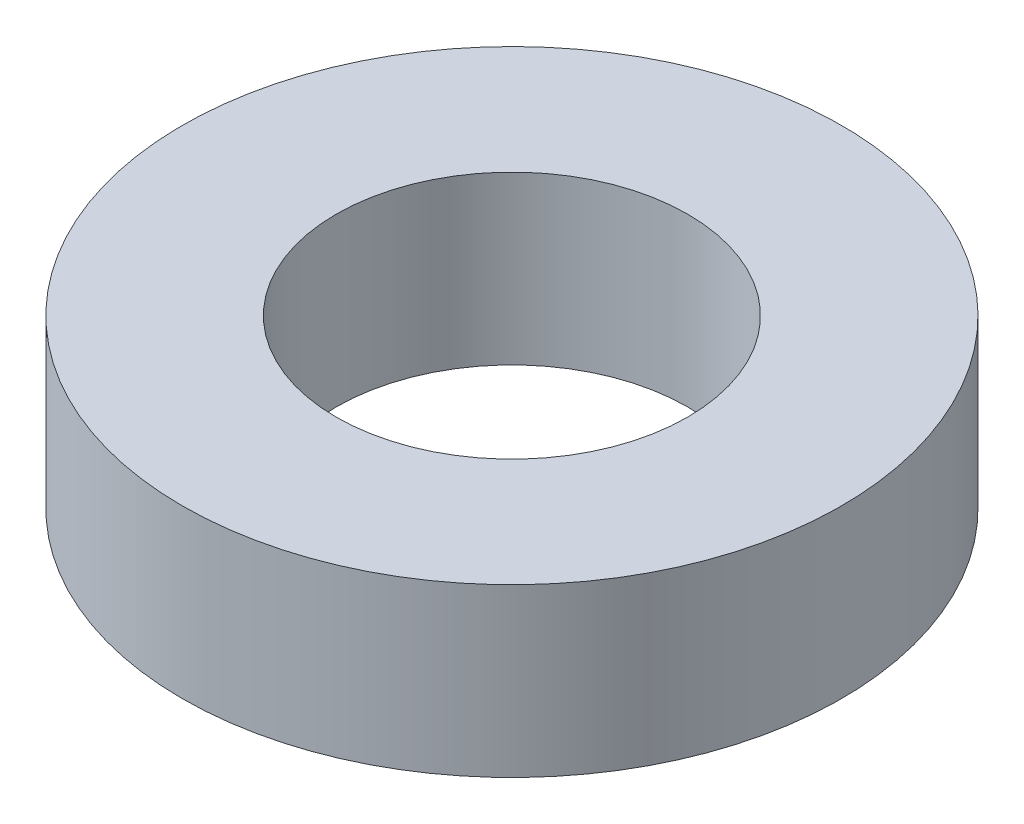
from build123d import *

# Parameters (mm, degrees)
SKETCH1_R           = 37.5
BOSS_EXTRUDE1_DEPTH = 19
SKETCH2_R           = 20
CUT_EXTRUDE1_DEPTH  = 57.333826428


with BuildPart() as part:
    # Sketch1 → Boss-Extrude1 (new body)
    with BuildSketch(Plane(origin=(0, 0, 0), x_dir=(1, 0, 0), z_dir=(0, 1, 0))):
        Circle(SKETCH1_R)
    extrude(amount=BOSS_EXTRUDE1_DEPTH)

    # Sketch2 → Cut-Extrude1 (cut, through all)
    with BuildSketch(Plane(origin=(0, 0, 0), x_dir=(1, 0, 0), z_dir=(0, 1, 0))):
        Circle(SKETCH2_R)
    extrude(amount=CUT_EXTRUDE1_DEPTH, mode=Mode.SUBTRACT)


solid = part.part
